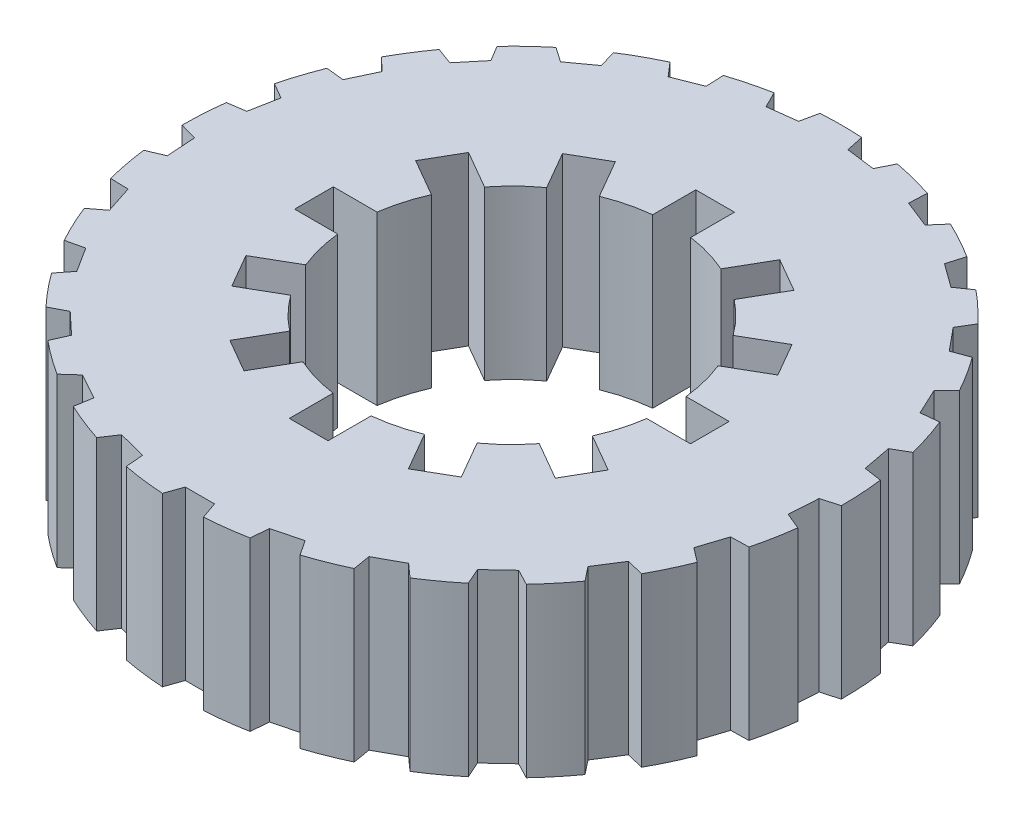
from build123d import *

# Parameters (mm, degrees)
SKETCH1_R           = 37.465
BOSS_EXTRUDE1_DEPTH = 19.05
CUT_EXTRUDE1_DEPTH  = 33
CIRPATTERN1_COUNT   = 25
CUT_EXTRUDE2_DEPTH  = 28
CUT_EXTRUDE8_DEPTH  = 23
CIRPATTERN2_COUNT   = 12


with BuildPart() as part:
    # Sketch1 → Boss-Extrude1 (new body)
    with BuildSketch(Plane(origin=(0, 0, 0), x_dir=(1, 0, 0), z_dir=(0, 1, 0))):
        Circle(SKETCH1_R)
    extrude(amount=BOSS_EXTRUDE1_DEPTH)

    # Sketch2 → Cut-Extrude1 (cut)
    with BuildSketch(Plane.XZ):
        Polygon((0, 37.465), (-2.36, 37.465), (-1.66, 35.465), (0, 35.465), (1.66, 35.465), (2.36, 37.465), align=None)
    cut_extrude1 = extrude(amount=-CUT_EXTRUDE1_DEPTH, mode=Mode.SUBTRACT)

    # CirPattern1: Cut-Extrude1 ×25 about axis
    cirpattern1_axis = Axis((0, 0, 0), (0, 1, 0))
    for i in range(1, CIRPATTERN1_COUNT):
        add(cut_extrude1.rotate(cirpattern1_axis, i * 360 / CIRPATTERN1_COUNT), mode=Mode.SUBTRACT)

    # Sketch3 → Cut-Extrude2 (cut)
    with BuildSketch(Plane(origin=(0, 19.05, 0), x_dir=(1, 0, 0), z_dir=(0, 1, 0))):
        with BuildLine():
            ThreePointArc((2.5, 17.82554347), (0.302266808, 17.997461898), (-1.9, 17.899441332))
            ThreePointArc((-1.9, 17.899441332), (-12.037441589, -13.382824814), (18, 0))
            ThreePointArc((18, 0), (13.583077707, 11.811011811), (2.5, 17.82554347))
        make_face()
    extrude(amount=-CUT_EXTRUDE2_DEPTH, mode=Mode.SUBTRACT)

    # Sketch3<7> → Cut-Extrude8 (cut)
    with BuildSketch(Plane(origin=(0, 19.05, 0), x_dir=(1, 0, 0), z_dir=(0, 1, 0))):
        with BuildLine():
            Line((0.3, 22.8), (-1.9, 22.8))
            Line((-1.9, 22.8), (-1.9, 17.899441332))
            ThreePointArc((-1.9, 17.899441332), (0.302266808, 17.997461898), (2.5, 17.82554347))
            Line((2.5, 17.82554347), (2.5, 22.8))
            Line((2.5, 22.8), (0.3, 22.8))
        make_face()
    cut_extrude8 = extrude(amount=-CUT_EXTRUDE8_DEPTH, mode=Mode.SUBTRACT)

    # CirPattern2: Cut-Extrude8 ×12 about axis
    cirpattern2_axis = Axis((0, 19.05, 0), (0, 1, 0))
    for i in range(1, CIRPATTERN2_COUNT):
        add(cut_extrude8.rotate(cirpattern2_axis, i * 360 / CIRPATTERN2_COUNT), mode=Mode.SUBTRACT)


solid = part.part
